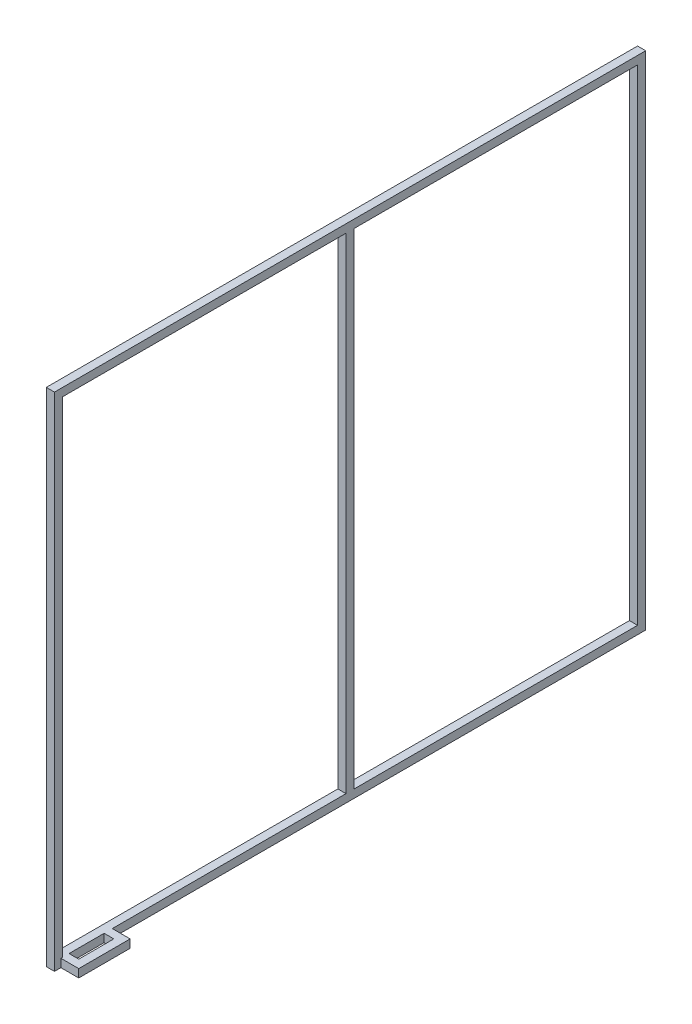
from build123d import *

# Parameters (mm, degrees)
SKETCH1_W           = 1118.25
SKETCH1_H           = 944.035
BOSS_EXTRUDE1_DEPTH = 15.875
SKETCH2_W           = 50.625
SKETCH2_H           = 100
SKETCH2_W_2         = 18.875
SKETCH2_H_2         = 68.25
BOSS_EXTRUDE2_DEPTH = 15.875
BOSS_EXTRUDE3_REACH = 1122.096
SKETCH3_W           = 15.875
SKETCH3_H           = 15.875


with BuildPart() as part:
    # Sketch1 → Boss-Extrude1 (new body)
    with BuildSketch(Plane(origin=(0, 0, 0), x_dir=(0, 0, -1), z_dir=(1, 0, 0))):
        Polygon((-575, -487.8925), (-575, 487.8925), (575, 487.8925), (575, -487.8925), (559.125, -487.8925), (-559.125, -487.8925), align=None)
        Rectangle(SKETCH1_W, SKETCH1_H, mode=Mode.SUBTRACT)
    extrude(amount=BOSS_EXTRUDE1_DEPTH)

    # Sketch2 → Boss-Extrude2 (add)
    with BuildSketch(Plane.XZ.offset(487.8925)):
        with Locations((25.3125, 512.5)):
            Rectangle(SKETCH2_W, SKETCH2_H)
        with Locations((25.3125, 512.5)):
            Rectangle(SKETCH2_W_2, SKETCH2_H_2, mode=Mode.SUBTRACT)
    extrude(amount=-BOSS_EXTRUDE2_DEPTH)

    # Sketch3 → Boss-Extrude3 (add, up to next)
    with BuildSketch(Plane(origin=(0, -472.0175, 0), x_dir=(1, 0, 0), z_dir=(0, 1, 0)), mode=Mode.PRIVATE) as boss_extrude3_sk1:
        with Locations((7.9375, 0)):
            Rectangle(SKETCH3_W, SKETCH3_H)
    boss_extrude3_tool1 = extrude(boss_extrude3_sk1.sketch, amount=BOSS_EXTRUDE3_REACH, mode=Mode.PRIVATE) - part.part
    add(boss_extrude3_tool1.solids().sort_by_distance((7.9375, -472.0175, 0))[0])


solid = part.part
